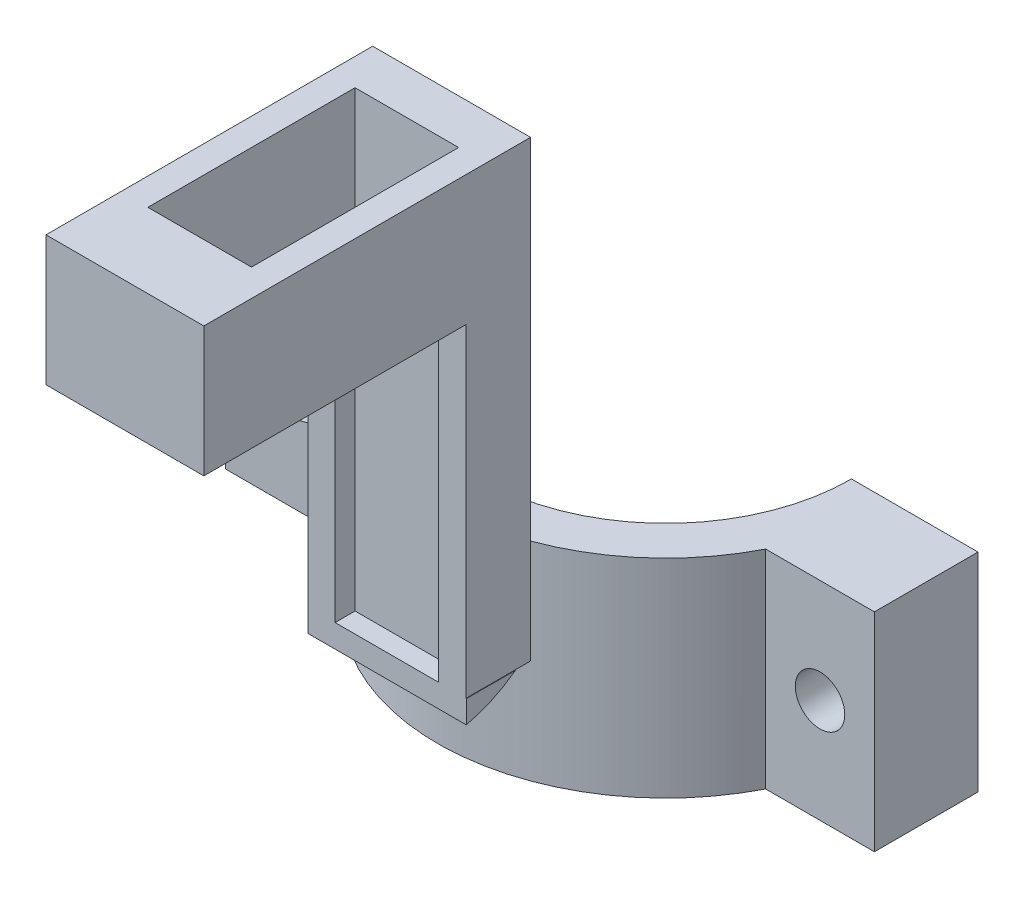
from build123d import *

# Parameters (mm, degrees)
SKETCH_1_R                = 17.63
SKETCH_1_R_2              = 14.34
EXTRUDE_1_DEPTH           = 16.05
EXTRUDE_1_2_DEPTH         = 9.77
EXTRUDE_1_2_DEPTH_BACK    = 3
SKETCH_2_W                = 16
SKETCH_2_H                = 16.05
SKETCH_3_W                = 3.41
SKETCH_3_H                = 16
CUT_EXTRUDE_1_DEPTH       = 37.411121927
SKETCH_4_R                = 1.91
CUT_EXTRUDE_2_DEPTH       = 39.675463798
EXTRUDE_2_DEPTH           = 4
EXTRUDE_2_DEPTH_BACK      = 2.77
SKETCH_5_W                = 12.19
SKETCH_5_H                = 8.263625949
SKETCH_6_W                = 12.19
SKETCH_6_H                = 6.77
EXTRUDE_3_DEPTH           = 63
SKETCH_8_W                = 12.19
SKETCH_8_H                = 6.77
EXTRUDE_4_DEPTH           = 0.16
EXTRUDE_5_DEPTH           = 3.16
EXTRUDE_5_DEPTH_BACK      = 10
SKETCH_12_W               = 16
SKETCH_12_H               = 16.05
SKETCH_13_W               = 1.21
SKETCH_13_H               = 16
CUT_EXTRUDE_3_DEPTH       = 73.543164889
SKETCH_14_R               = 1.91
CUT_EXTRUDE_4_DEPTH       = 90.07387176
SKETCH_15_R               = 4.05
CUT_EXTRUDE_5_DEPTH       = 24
SKETCH_16_W               = 56.400519221
SKETCH_16_H               = 19.935010357
CUT_EXTRUDE_6_DEPTH       = 73.088971918
SKETCH_17_W               = 12.19
SKETCH_17_H               = 71.423625949
EXTRUDE_7_DEPTH           = 25
SKETCH_18_W               = 26.793372528
SKETCH_18_H               = 63.398625949
CUT_EXTRUDE_7_DEPTH       = 25
SKETCH_19_R               = 4
CUT_EXTRUDE_8_DEPTH       = 24
CUT_EXTRUDE_9_DEPTH       = 29
EXTRUDE_9_DEPTH           = 2
FILLET_1_R                = 10
SKETCH_24_W               = 12.19
SKETCH_24_H               = 5
EXTRUDE_10_DEPTH          = 27
SKETCH_27_W               = 12.19
SKETCH_27_H               = 10.03
EXTRUDE_11_DEPTH          = 20.23
CUT_EXTRUDE_10_DEPTH      = 45.23
CUT_EXTRUDE_10_DEPTH_BACK = 8
SKETCH_21_W               = 8
SKETCH_21_H               = 16
SKETCH_25_W               = 20.230462415
SKETCH_25_H               = 10.025
CUT_EXTRUDE_12_DEPTH      = 20.23
SKETCH_31_W               = 8
SKETCH_31_H               = 2.03
EXTRUDE_13_DEPTH          = 16.23


with BuildPart() as part:
    # 草圖1 → Extrude 1 (new body)
    with BuildSketch(Plane(origin=(0, 0, 0), x_dir=(1, 0, 0), z_dir=(0, 1, 0))):
        Circle(SKETCH_1_R)
        Circle(SKETCH_1_R_2, mode=Mode.SUBTRACT)
    extrude(amount=EXTRUDE_1_DEPTH)

    # 草圖2 → Extrude 1 2 (add, two sides: drawn at the far end of the back side and taken through both)
    with BuildSketch(Plane(origin=(17.75, 0, 0), x_dir=(0, 0, -1), z_dir=(1, 0, 0)).offset(-EXTRUDE_1_2_DEPTH_BACK)):
        with Locations((0, 8.025)):
            Rectangle(SKETCH_2_W, SKETCH_2_H)
    extrude(amount=EXTRUDE_1_2_DEPTH + EXTRUDE_1_2_DEPTH_BACK)

    # 草圖3 → 除料-伸長1 (cut, through all)
    with BuildSketch(Plane(origin=(0, 16.05, 0), x_dir=(1, 0, 0), z_dir=(0, 1, 0))):
        with Locations((25.815, 0)):
            Rectangle(SKETCH_3_W, SKETCH_3_H)
    extrude(amount=-CUT_EXTRUDE_1_DEPTH, mode=Mode.SUBTRACT)

    # 草圖4 → 除料-伸長2 (cut, through all)
    with BuildSketch(Plane.XY.offset(8)):
        with Locations((19.910203689, 8.025)):
            Circle(SKETCH_4_R)
    extrude(amount=-CUT_EXTRUDE_2_DEPTH, mode=Mode.SUBTRACT)

    # 草圖5 → 填料-伸長2 (add, two sides: drawn at the far end of the back side and taken through both)
    with BuildSketch(Plane.XY.offset(17.75).offset(-EXTRUDE_2_DEPTH_BACK)):
        with Locations((0, 12.156812974)):
            Rectangle(SKETCH_5_W, SKETCH_5_H)
    extrude(amount=EXTRUDE_2_DEPTH + EXTRUDE_2_DEPTH_BACK)

    # 草圖6 → 填料-伸長3 (add)
    with BuildSketch(Plane(origin=(0, 16.288625949, 0), x_dir=(1, 0, 0), z_dir=(0, 1, 0))):
        with Locations((0, -18.365)):
            Rectangle(SKETCH_6_W, SKETCH_6_H)
    extrude(amount=EXTRUDE_3_DEPTH)

    # 草圖8 → 填料-伸長4 (add)
    with BuildSketch(Plane(origin=(0, 79.288625949, 0), x_dir=(1, 0, 0), z_dir=(0, 1, 0))):
        with Locations((0, -18.365)):
            Rectangle(SKETCH_8_W, SKETCH_8_H)
    extrude(amount=EXTRUDE_4_DEPTH)

    # 草圖12 → 填料-伸長5 (add, two sides: drawn at the far end of the back side and taken through both)
    with BuildSketch(Plane(origin=(-17.75, 0, 0), x_dir=(0, 0, -1), z_dir=(1, 0, 0)).offset(-EXTRUDE_5_DEPTH_BACK)):
        with Locations((0.543544944, 8.025)):
            Rectangle(SKETCH_12_W, SKETCH_12_H)
    extrude(amount=EXTRUDE_5_DEPTH + EXTRUDE_5_DEPTH_BACK)

    # 草圖13 → 除料-伸長3 (cut, through all)
    with BuildSketch(Plane(origin=(0, 16.05, 0), x_dir=(1, 0, 0), z_dir=(0, 1, 0))):
        with Locations((-27.145, 0.543544944)):
            Rectangle(SKETCH_13_W, SKETCH_13_H)
    extrude(amount=-CUT_EXTRUDE_3_DEPTH, mode=Mode.SUBTRACT)

    # 草圖14 → 除料-伸長4 (cut, through all)
    with BuildSketch(Plane(origin=(0, 0, -8.543544944), x_dir=(-1, 0, 0), z_dir=(0, 0, -1))):
        with Locations(Location((20.980783679, 8.025, 0), (0, 0, 90))):
            Circle(SKETCH_14_R)
    extrude(amount=-CUT_EXTRUDE_4_DEPTH, mode=Mode.SUBTRACT)

    # 草圖15 → 除料-伸長5 (cut)
    with BuildSketch(Plane(origin=(0, 79.448625949, 0), x_dir=(1, 0, 0), z_dir=(0, 1, 0))):
        with Locations((0, -14.98)):
            Circle(SKETCH_15_R)
    extrude(amount=-CUT_EXTRUDE_5_DEPTH, mode=Mode.SUBTRACT)

    # 草圖16 → 除料-伸長6 (cut, through all)
    with BuildSketch(Plane(origin=(0, 16.05, 0), x_dir=(1, 0, 0), z_dir=(0, 1, 0))):
        with Locations((-4.090259611, 9.967505179)):
            Rectangle(SKETCH_16_W, SKETCH_16_H)
    extrude(amount=-CUT_EXTRUDE_6_DEPTH, mode=Mode.SUBTRACT)

    # 草圖17 → 填料-伸長7 (add)
    with BuildSketch(Plane.XY.offset(21.75)):
        with Locations((0, 43.736812975)):
            Rectangle(SKETCH_17_W, SKETCH_17_H)
    extrude(amount=EXTRUDE_7_DEPTH)

    # 草圖18 → 除料-伸長7 (cut)
    with BuildSketch(Plane.ZY.offset(6.095)):
        with Locations((28.376686264, 47.749312975)):
            Rectangle(SKETCH_18_W, SKETCH_18_H)
    extrude(amount=-CUT_EXTRUDE_7_DEPTH, mode=Mode.SUBTRACT)

    # 草圖19 → 除料-伸長8 (cut)
    with BuildSketch(Plane(origin=(0, 79.448625949, 0), x_dir=(1, 0, 0), z_dir=(0, 1, 0))):
        with Locations((0, -41.773372528)):
            Circle(SKETCH_19_R)
    extrude(amount=-CUT_EXTRUDE_8_DEPTH, mode=Mode.SUBTRACT)

    # 草圖20 → 除料-伸長9 (cut)
    with BuildSketch(Plane(origin=(6.095, 0, 0), x_dir=(0, 0, -1), z_dir=(1, 0, 0))):
        Polygon((-41.773372528, 16.05), (-41.773372528, 8.025), (-46.75, 8.025), (-46.75, 79.448625949), (-41.773372528, 79.448625949), align=None)
    extrude(amount=-CUT_EXTRUDE_9_DEPTH, mode=Mode.SUBTRACT)

    # 草圖23 → 填料-伸長9 (add)
    with BuildSketch(Plane.XZ.offset(-8.025)):
        Polygon((-6.095, 41.773372528), (-6.095, 17.75), (6.13829314, 17.75), (6.095, 41.773372528), align=None)
    extrude(amount=EXTRUDE_9_DEPTH)

    # 圓角1
    # the kernel refuses this fillet: 10 mm, written as the material it takes off along each edge
    with BuildSketch(Plane(origin=(-21.095, 6.025, 17.75), x_dir=(0, 1, 0), z_dir=(1, 0, 0))) as fillet_1_piece_1:
        with BuildLine():
            CenterArc((10, 6), FILLET_1_R, 180, 36.869897646)
            Line((0, 6), (0, 0))
            Line((0, 0), (2, 0))
        make_face()
    extrude(amount=42.23329314, mode=Mode.SUBTRACT)

    # 草圖24 → 填料-伸長10 (add)
    with BuildSketch(Plane(origin=(0, 16.05, 0), x_dir=(1, 0, 0), z_dir=(0, 1, 0))):
        with Locations((0, -19.042910113)):
            Rectangle(SKETCH_24_W, SKETCH_24_H)
    extrude(amount=EXTRUDE_10_DEPTH)

    # 草圖27 → 填料-伸長11 (add)
    with BuildSketch(Plane.XY.offset(21.542910113)):
        with Locations((0, 38.035)):
            Rectangle(SKETCH_27_W, SKETCH_27_H)
    extrude(amount=EXTRUDE_11_DEPTH)

    # 草圖21 → 除料-伸長10 (cut, two sides: drawn at the far end of the back side and taken through both)
    with BuildSketch(Plane(origin=(0, 16.05, 0), x_dir=(1, 0, 0), z_dir=(0, 1, 0)).offset(-CUT_EXTRUDE_10_DEPTH_BACK)):
        with Locations((0, -28)):
            Rectangle(SKETCH_21_W, SKETCH_21_H)
    extrude(amount=CUT_EXTRUDE_10_DEPTH + CUT_EXTRUDE_10_DEPTH_BACK, mode=Mode.SUBTRACT)

    # 草圖25 → 除料-伸長12 (cut)
    with BuildSketch(Plane.ZY.offset(6.095)):
        with Locations((31.658141321, 11.0375)):
            Rectangle(SKETCH_25_W, SKETCH_25_H)
    extrude(amount=-CUT_EXTRUDE_12_DEPTH, mode=Mode.SUBTRACT)

    # 草圖31 → 填料-伸長13 (add)
    with BuildSketch(Plane(origin=(0, 0, 36), x_dir=(-1, 0, 0), z_dir=(0, 0, -1))):
        with Locations((0, 34.035)):
            Rectangle(SKETCH_31_W, SKETCH_31_H)
    extrude(amount=EXTRUDE_13_DEPTH)


solid = part.part
